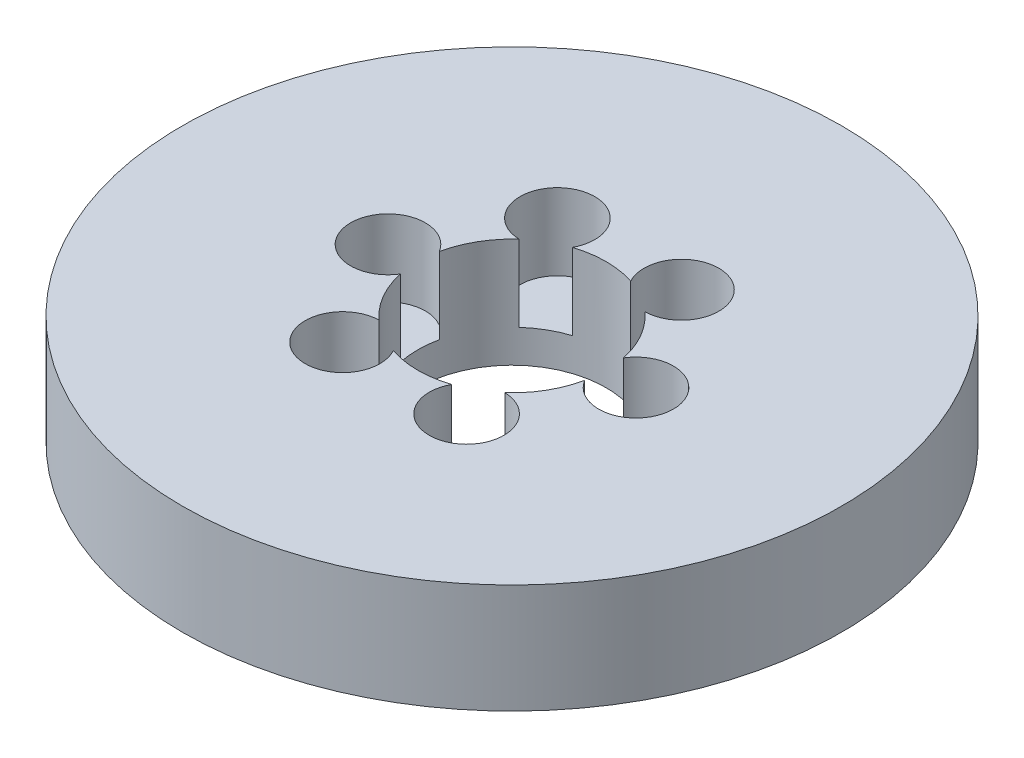
from build123d import *

# Parameters (mm, degrees)
SKETCH1_R           = 87.5
BOSS_EXTRUDE1_DEPTH = 29
SKETCH2_R           = 25
CUT_EXTRUDE1_DEPTH  = 128.096420091
SKETCH3_R           = 9.921747731
CUT_EXTRUDE2_DEPTH  = 20.272624351
CIRPATTERN1_COUNT   = 6


with BuildPart() as part:
    # Sketch1 → Boss-Extrude1 (new body)
    with BuildSketch(Plane(origin=(0, 0, 0), x_dir=(1, 0, 0), z_dir=(0, 1, 0))):
        Circle(SKETCH1_R)
    extrude(amount=BOSS_EXTRUDE1_DEPTH)

    # Sketch2 → Cut-Extrude1 (cut, through all)
    with BuildSketch(Plane(origin=(0, 0, 0), x_dir=(1, 0, 0), z_dir=(0, 1, 0))):
        Circle(SKETCH2_R)
    extrude(amount=CUT_EXTRUDE1_DEPTH, mode=Mode.SUBTRACT)

    # Sketch3 → Cut-Extrude2 (cut)
    with BuildSketch(Plane(origin=(0, 29, 0), x_dir=(1, 0, 0), z_dir=(0, 1, 0))):
        with Locations((-32.93055591, 0)):
            Circle(SKETCH3_R)
    cut_extrude2 = extrude(amount=-CUT_EXTRUDE2_DEPTH, mode=Mode.SUBTRACT)

    # CirPattern1: Cut-Extrude2 ×6 about axis
    cirpattern1_axis = Axis((0, 0, 0), (0, 1, 0))
    for i in range(1, CIRPATTERN1_COUNT):
        add(cut_extrude2.rotate(cirpattern1_axis, i * 360 / CIRPATTERN1_COUNT), mode=Mode.SUBTRACT)


solid = part.part
